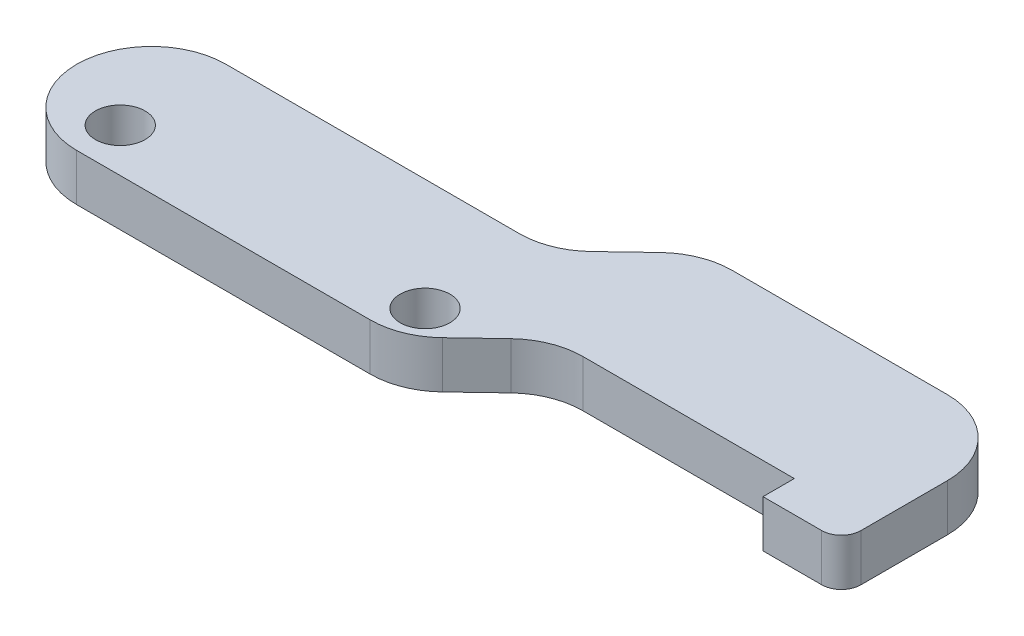
from build123d import *

# Parameters (mm, degrees)
SKETCH1_R           = 19.84375
BOSS_EXTRUDE1_DEPTH = 37.5
FILLET1_R           = 59.53125
FILLET3_R           = 15.625


with BuildPart() as part:
    # Sketch1 → Boss-Extrude1 (new body)
    with BuildSketch(Plane(origin=(0, 0, 0), x_dir=(1, 0, 0), z_dir=(0, 1, 0))):
        Polygon((-317.5, -34.7265625), (-317.5, 84.3359375), (0, 84.3359375), (62.5, 143.8671875), (317.5, 143.8671875), (317.5, 24.8046875), (317.5, -0.1953125), (255, -0.1953125), (255, 24.8046875), (62.5, 24.8046875), (0, -34.7265625), align=None)
        with Locations(Location((-257.96875, 0, 0), (0, 0, 270))):
            Circle(SKETCH1_R, mode=Mode.SUBTRACT)
        with Locations(Location((-9.839661148, -4.9609375, 0), (0, 0, 270))):
            Circle(SKETCH1_R, mode=Mode.SUBTRACT)
    extrude(amount=BOSS_EXTRUDE1_DEPTH)

    # Fillet1
    fillet1_edges = [part.edges().sort_by_distance(p)[0] for p in [
        (62.5, 18.75, -24.8046875),
        (0, 18.75, 34.7265625),
        (0, 18.75, -84.3359375),
        (62.5, 18.75, -143.8671875),
        (317.5, 18.75, -143.8671875),
        (-317.5, 18.75, 34.7265625),
        (-317.5, 18.75, -84.3359375),
    ]]
    fillet(fillet1_edges, radius=FILLET1_R - 0.0001)  # a hair under: the kernel refuses the full size

    # Fillet3
    fillet3_edges = [part.edges().sort_by_distance(p)[0] for p in [
        (317.5, 18.75, 0.1953125),
    ]]
    fillet(fillet3_edges, radius=FILLET3_R)


solid = part.part
